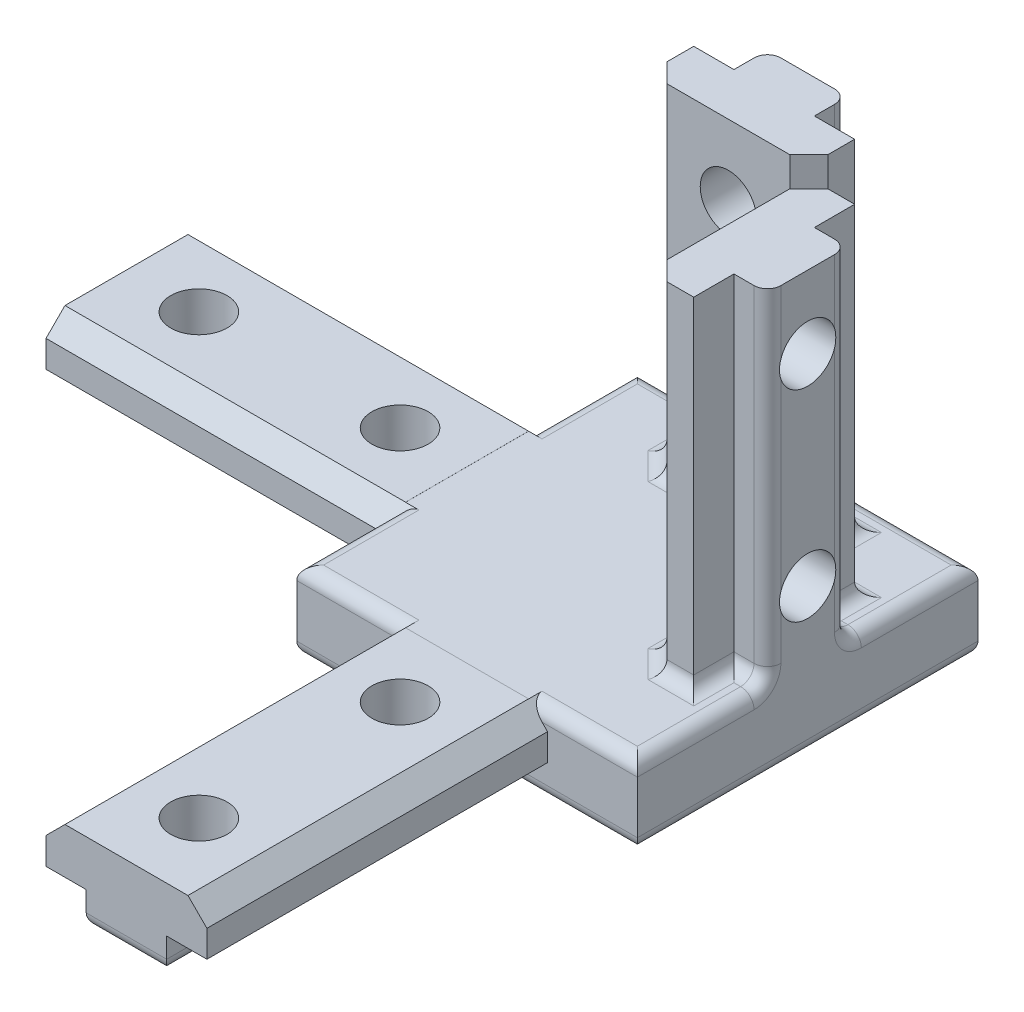
from build123d import *

# Parameters (mm, degrees)
SKETCH1_W             = 25.4
SKETCH1_H             = 25.4
BOSS_EXTRUDE1_DEPTH   = 5.91
BOSS_EXTRUDE2_DEPTH   = 25.4
BOSS_EXTRUDE3_DEPTH   = 25.4
BOSS_EXTRUDE4_DEPTH   = 25.4
FILLET2_R             = 1
M5X0_8_TAPPED_HOLE2_D = 4.2
M5X0_8_TAPPED_HOLE3_D = 4.2
M5X0_8_TAPPED_HOLE4_D = 4.2


with BuildPart() as part:
    # Sketch1 → Boss-Extrude1 (new body)
    with BuildSketch(Plane(origin=(0, 0, 0), x_dir=(1, 0, 0), z_dir=(0, 1, 0))):
        Rectangle(SKETCH1_W, SKETCH1_H)
    extrude(amount=BOSS_EXTRUDE1_DEPTH)

    # Sketch2 → Boss-Extrude2 (add)
    with BuildSketch(Plane.XY.offset(12.7)):
        Polygon((-3, 0), (3, 0), (3, 2.5), (6, 2.5), (6, 4.5), (4.585786438, 5.914213562), (-4.585786438, 5.914213562), (-6, 4.5), (-6, 2.5), (-3, 2.5), align=None)
    extrude(amount=BOSS_EXTRUDE2_DEPTH)

    # Sketch3 → Boss-Extrude3 (add)
    with BuildSketch(Plane.ZY.offset(12.7)):
        Polygon((-3, 0), (3, 0), (3, 2.5), (6, 2.5), (6, 4.5), (4.585786438, 5.914213562), (-4.585786438, 5.914213562), (-6, 4.5), (-6, 2.5), (-3, 2.5), align=None)
    extrude(amount=BOSS_EXTRUDE3_DEPTH)

    # Sketch5 → Boss-Extrude4 (add)
    with BuildSketch(Plane(origin=(0, 5.91, 0), x_dir=(1, 0, 0), z_dir=(0, 1, 0))):
        Polygon((3, 12.7), (-3, 12.7), (-3, 10.2), (-6, 10.2), (-6, 8.2), (-4.585786438, 6.785786438), (4.585786438, 6.785786438), (6, 8.2), (6, 10.2), (3, 10.2), align=None)
        Polygon((12.7, -3), (12.7, 3), (10.2, 3), (10.2, 6), (8.2, 6), (6.785786438, 4.585786438), (6.785786438, -4.585786438), (8.2, -6), (10.2, -6), (10.2, -3), align=None)
    extrude(amount=BOSS_EXTRUDE4_DEPTH)

    # Fillet2
    fillet2_edges = [part.edges().sort_by_distance(p)[0] for p in [
        (3, 18.61, -12.7),
        (12.7, 18.61, -3),
        (12.7, 18.61, 3),
        (-3, 18.61, -12.7),
        (-6, 5.91, -9.2),
        (-5.292893219, 5.91, -7.492893219),
        (0, 5.91, -6.785786438),
        (5.292893219, 5.91, -7.492893219),
        (6, 5.91, -9.2),
        (4.5, 5.91, -10.2),
        (3, 5.91, -11.45),
        (7.85, 5.91, -12.7),
        (12.7, 5.91, -7.85),
        (11.45, 5.91, -3),
        (10.2, 5.91, -4.5),
        (9.2, 5.91, -6),
        (7.492893219, 5.91, -5.292893219),
        (6.785786438, 5.91, 0),
        (7.492893219, 5.91, 5.292893219),
        (9.2, 5.91, 6),
        (10.2, 5.91, 4.5),
        (11.45, 5.91, 3),
        (12.7, 5.91, 7.85),
        (8.645, 5.91, 12.7),
        (-8.645, 5.91, 12.7),
        (-12.7, 5.91, 8.645),
        (-12.7, 5.91, -8.645),
        (-7.85, 5.91, -12.7),
        (-3, 5.91, -11.45),
        (-4.5, 5.91, -10.2),
        (0, 0, -12.7),
        (-12.7, 0, -7.85),
        (-25.4, 0, -3),
        (-38.1, 0, 0),
        (-25.4, 0, 3),
        (-12.7, 0, 7.85),
        (-7.85, 0, 12.7),
        (-3, 0, 25.4),
        (0, 0, 38.1),
        (3, 0, 25.4),
        (7.85, 0, 12.7),
        (12.7, 0, 0),
    ]]
    fillet(fillet2_edges, radius=FILLET2_R)

    # M5x0.8 Tapped Hole2 (through all)
    with Locations(Plane(origin=(0, 0, 0), x_dir=(-1, 0, 0), z_dir=(0, -1, 0))):
        with Locations((0, -17.7), (0, -32.7), (17.7, 0), (32.7, 0)):
            Hole(M5X0_8_TAPPED_HOLE2_D / 2)

    # M5x0.8 Tapped Hole3 (through all)
    with Locations(Plane(origin=(12.7, 0, 0), x_dir=(0, 0, -1), z_dir=(1, 0, 0))):
        with Locations((0, 10.91), (0, 25.91)):
            Hole(M5X0_8_TAPPED_HOLE3_D / 2)

    # M5x0.8 Tapped Hole4 (through all)
    with Locations(Plane(origin=(0, 0, -12.7), x_dir=(-1, 0, 0), z_dir=(0, 0, -1))):
        with Locations((0, 25.91), (0, 10.91)):
            Hole(M5X0_8_TAPPED_HOLE4_D / 2)


solid = part.part
